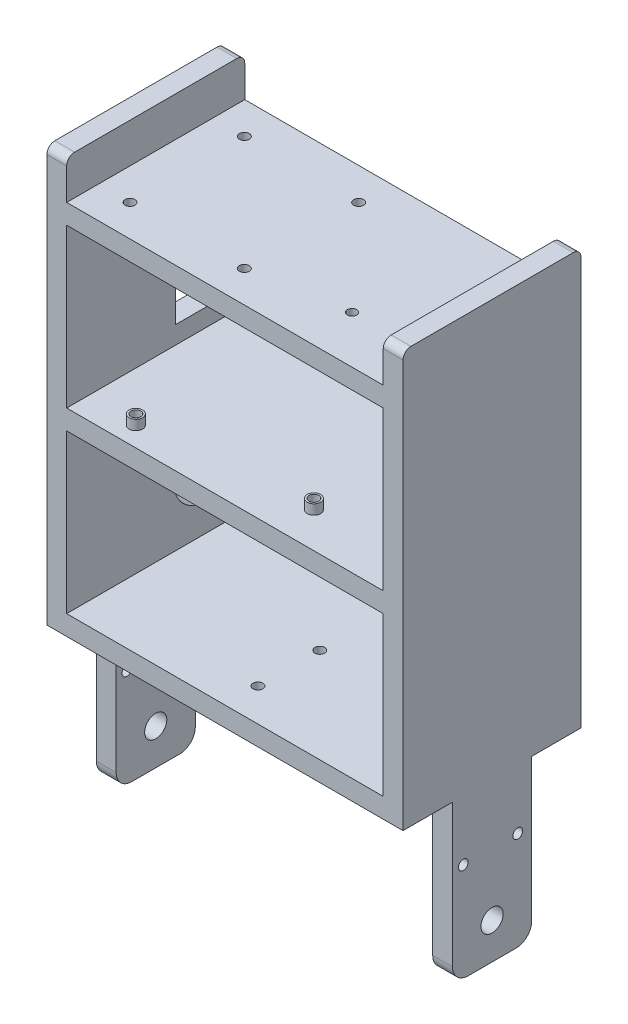
from build123d import *
from build123d.topology import SkipClean

# Parameters (mm, degrees)
SKETCH1_W                = 6.35
SKETCH1_H                = 127
SKETCH1_W_2              = 101.6
SKETCH1_H_2              = 6.35
BOSS_EXTRUDE1_DEPTH      = 57.15
SKETCH2_W                = 25.4
SKETCH2_H                = 50.8
BOSS_EXTRUDE2_DEPTH      = 6.35
BOSS_EXTRUDE3_DEPTH      = 0.508
FILLET1_R                = 5.00126
CUT_EXTRUDE8_DEPTH       = 181.488225001
SKETCH7_R                = 1.5748
CUT_EXTRUDE2_DEPTH       = 181.165514181
CUT_EXTRUDE3_DEPTH       = 6.35
BOSS_EXTRUDE6_START      = 3.81
BOSS_EXTRUDE6_DEPTH      = 3.81
SKETCH10_R               = 1.5875
CUT_EXTRUDE5_DEPTH       = 6.35
SKETCH11_R               = 1.5875
CUT_EXTRUDE6_DEPTH       = 6.35
SKETCH12_R               = 1.49987
CUT_EXTRUDE7_DEPTH       = 6.35
SKETCH9_W                = 12.7
SKETCH9_H                = 10.922
CUT_EXTRUDE4_DEPTH       = 6.35
SKETCH10_5_R             = 2.159
SKETCH10_5_R_2           = 1.5875
BOSS_EXTRUDE9_DEPTH      = 3.175
BOSS_EXTRUDE9_2_DEPTH    = 3.175
BOSS_EXTRUDE9_3_DEPTH    = 3.175
BOSS_EXTRUDE9_4_DEPTH    = 3.175
CUT_EXTRUDE9_START       = -6.35
CUT_EXTRUDE9_DEPTH       = 114.3
CUT_EXTRUDE9_2_OUTLINE_R = 1.5875
CUT_EXTRUDE9_2_DEPTH     = 6.35


# Read off the part's stored shape, not the designer's step: Cut-Extrude9
with BuildPart() as part:
    # Sketch1 → Boss-Extrude1 (new body)
    with BuildSketch(Plane.XY):
        with Locations((104.775, 63.5)):
            Rectangle(SKETCH1_W, SKETCH1_H)
        with Locations((-3.175, 63.5)):
            Rectangle(SKETCH1_W, SKETCH1_H)
        with Locations((50.8, 111.125)):
            Rectangle(SKETCH1_W_2, SKETCH1_H_2)
        with Locations((50.8, 53.975)):
            Rectangle(SKETCH1_W_2, SKETCH1_H_2)
        Polygon((107.95, -6.35), (101.6, -6.35), (0, -6.35), (-6.35, -6.35), (-6.35, 0), (0, 0), (101.6, 0), (107.95, 0), align=None)
    extrude(amount=-BOSS_EXTRUDE1_DEPTH)

    # Sketch2 → Boss-Extrude2 (add)
    with BuildSketch(Plane(origin=(107.95, 0, 0), x_dir=(0, 0, -1), z_dir=(1, 0, 0))):
        with Locations((28.575, -31.75)):
            Rectangle(SKETCH2_W, SKETCH2_H)
    boss_extrude2 = extrude(amount=-BOSS_EXTRUDE2_DEPTH)

    # Mirror1: Boss-Extrude2 across plane
    add(boss_extrude2.mirror(Plane(origin=(50.8, 0, 0), x_dir=(0, 0, 1), z_dir=(1, 0, 0))))

    # Sketch4 → Boss-Extrude3 (add)
    with BuildSketch(Plane.ZY.offset(6.35)):
        Polygon((-28.657476896, 66.071615527), (-28.737119471, 75.236068065), (-27.523959323, 75.247180983), (-27.453577513, 67.164385737), (-22.939880901, 67.203280948), (-22.930620136, 66.121623655), align=None)
        Polygon((-28.44342412, 49.573585988), (-28.523066695, 58.738038526), (-21.897915779, 58.795455265), (-21.888655015, 57.713797973), (-27.300645782, 57.665641998), (-27.276567795, 54.859630358), (-22.207225313, 54.904082027), (-22.197964549, 53.827981194), (-27.26730703, 53.783529524), (-27.239524737, 50.664504044), (-21.614536386, 50.714512173), (-21.605275622, 49.63285488), align=None)
        Polygon((-28.29340319, 31.651300701), (-28.373045764, 40.815753239), (-21.747894849, 40.873169979), (-21.738634085, 39.791512686), (-27.150624852, 39.743356711), (-27.126546864, 36.937345071), (-22.057204383, 36.981796741), (-22.047943619, 35.905695907), (-27.1172861, 35.861244237), (-27.089503806, 32.742218758), (-21.464515456, 32.792226886), (-21.455254691, 31.710569593), align=None)
        Polygon((-28.219320528, 13.727163261), (-28.298963103, 22.891615799), (-27.085802955, 22.902728717), (-27.046907744, 18.357545506), (-22.535063285, 22.941623927), (-20.890351512, 22.956441151), (-24.703934328, 19.209535839), (-20.642163024, 13.793840765), (-22.242423127, 13.779023542), (-25.546663897, 18.389032105), (-27.033942674, 16.914718398), (-27.00616038, 13.738276179), align=None)
    extrude(amount=BOSS_EXTRUDE3_DEPTH)

    # Fillet1
    fillet1_edges = [part.edges().sort_by_distance(p)[0] for p in [
        (104.775, -57.15, -41.275),
        (104.775, -57.15, -15.875),
        (-3.175, -57.15, -15.875),
        (-3.175, -57.15, -41.275),
    ]]
    fillet(fillet1_edges, radius=FILLET1_R)

    # Sketch5 → Cut-Extrude8 (cut, through all)
    with BuildSketch(Plane(origin=(107.95, 0, 0), x_dir=(0, 0, -1), z_dir=(1, 0, 0))):
        with BuildLine():
            ThreePointArc((25.019, -45.52696), (25.614159021, -44.090119021), (27.051, -43.49496))
            Line((27.051, -43.49496), (30.099, -43.49496))
            ThreePointArc((30.099, -43.49496), (31.535840979, -44.090119021), (32.131, -45.52696))
            ThreePointArc((32.131, -45.52696), (28.575, -41.97096), (25.019, -45.52696))
        make_face()
        with BuildLine():
            ThreePointArc((30.099, -47.55896), (32.131, -45.52696), (30.099, -43.49496))
            Line((30.099, -43.49496), (27.051, -43.49496))
            ThreePointArc((27.051, -43.49496), (25.019, -45.52696), (27.051, -47.55896))
            Line((27.051, -47.55896), (30.099, -47.55896))
        make_face()
        with BuildLine():
            ThreePointArc((27.051, -47.55896), (25.614159021, -46.963800979), (25.019, -45.52696))
            ThreePointArc((25.019, -45.52696), (28.575, -49.08296), (32.131, -45.52696))
            ThreePointArc((32.131, -45.52696), (31.535840979, -46.963800979), (30.099, -47.55896))
            Line((30.099, -47.55896), (27.051, -47.55896))
        make_face()
    extrude(amount=-CUT_EXTRUDE8_DEPTH, mode=Mode.SUBTRACT)

    # Sketch7 → Cut-Extrude2 (cut, through all)
    with BuildSketch(Plane.ZY.offset(6.35)):
        with Locations((-36.83508, -25.527)):
            Circle(SKETCH7_R)
        with Locations((-19.33448, -25.527)):
            Circle(SKETCH7_R)
    extrude(amount=-CUT_EXTRUDE2_DEPTH, mode=Mode.SUBTRACT)

    # Sketch8 → Cut-Extrude3 (cut)
    with BuildSketch(Plane.ZY.offset(6.35)):
        with BuildLine():
            ThreePointArc((-34.665970856, 21.27123), (-44.45, 29.083), (-54.234029144, 21.27123))
            Line((-54.234029144, 21.27123), (-34.665970856, 21.27123))
        make_face()
        with BuildLine():
            Line((-34.665970856, 21.27123), (-54.234029144, 21.27123))
            ThreePointArc((-54.234029144, 21.27123), (-54.483, 19.05), (-54.234029144, 16.82877))
            Line((-54.234029144, 16.82877), (-34.665970856, 16.82877))
            ThreePointArc((-34.665970856, 16.82877), (-34.479436992, 17.932430181), (-34.417, 19.05))
            ThreePointArc((-34.417, 19.05), (-34.479436992, 20.167569819), (-34.665970856, 21.27123))
        make_face()
        with BuildLine():
            Line((-34.665970856, 16.82877), (-54.234029144, 16.82877))
            ThreePointArc((-54.234029144, 16.82877), (-44.45, 9.017), (-34.665970856, 16.82877))
        make_face()
    extrude(amount=-CUT_EXTRUDE3_DEPTH, mode=Mode.SUBTRACT)

    # Sketch8<3> → Boss-Extrude6 (add)
    with SkipClean():  # the faces are left unmerged after this step: merging them gives an invalid solid
        with BuildSketch(Plane.ZY.offset(6.35).offset(BOSS_EXTRUDE6_START)):
            with BuildLine():
                ThreePointArc((-33.108466317, 21.27123), (-44.45, 30.607), (-55.791533683, 21.27123))
                Line((-55.791533683, 21.27123), (-54.234029144, 21.27123))
                ThreePointArc((-54.234029144, 21.27123), (-44.45, 29.083), (-34.665970856, 21.27123))
                Line((-34.665970856, 21.27123), (-33.108466317, 21.27123))
            make_face()
            with BuildLine():
                Line((-54.234029144, 16.82877), (-55.791533683, 16.82877))
                ThreePointArc((-55.791533683, 16.82877), (-44.45, 7.493), (-33.108466317, 16.82877))
                Line((-33.108466317, 16.82877), (-34.665970856, 16.82877))
                ThreePointArc((-34.665970856, 16.82877), (-44.45, 9.017), (-54.234029144, 16.82877))
            make_face()
        extrude(amount=-BOSS_EXTRUDE6_DEPTH)

    # Sketch10 → Cut-Extrude5 (cut)
    with SkipClean():  # the faces are left unmerged after this step: merging them gives an invalid solid
        with BuildSketch(Plane(origin=(0, 57.15, 0), x_dir=(1, 0, 0), z_dir=(0, 1, 0))):
            with Locations(Location((15.875, 6.31698, 0), (0, 0, 270))):
                Circle(SKETCH10_R)
            with Locations(Location((67.945, 11.39698, 0), (0, 0, 270))):
                Circle(SKETCH10_R)
            with Locations(Location((67.945, 39.33698, 0), (0, 0, 270))):
                Circle(SKETCH10_R)
            with Locations(Location((17.145, 54.57698, 0), (0, 0, 270))):
                Circle(SKETCH10_R)
        extrude(amount=-CUT_EXTRUDE5_DEPTH, mode=Mode.SUBTRACT)

    # Sketch11 → Cut-Extrude6 (cut)
    with SkipClean():  # the faces are left unmerged after this step: merging them gives an invalid solid
        with BuildSketch(Plane(origin=(0, 114.3, 0), x_dir=(1, 0, 0), z_dir=(0, 1, 0))):
            with Locations(Location((10.16, 10.16, 0), (0, 0, 270))):
                Circle(SKETCH11_R)
            with Locations(Location((46.86046, 10.16, 0), (0, 0, 270))):
                Circle(SKETCH11_R)
            with Locations(Location((46.86046, 46.86046, 0), (0, 0, 270))):
                Circle(SKETCH11_R)
            with Locations(Location((10.16, 46.86046, 0), (0, 0, 270))):
                Circle(SKETCH11_R)
        extrude(amount=-CUT_EXTRUDE6_DEPTH, mode=Mode.SUBTRACT)

    # Sketch12 → Cut-Extrude7 (cut)
    with SkipClean():  # the faces are left unmerged after this step: merging them gives an invalid solid
        with BuildSketch(Plane(origin=(0, 114.3, 0), x_dir=(1, 0, 0), z_dir=(0, 1, 0))):
            with Locations(Location((91.345643218, 15.24, 0), (0, 0, 270))):
                Circle(SKETCH12_R)
            with Locations(Location((76.344403218, 15.24, 0), (0, 0, 270))):
                Circle(SKETCH12_R)
        extrude(amount=-CUT_EXTRUDE7_DEPTH, mode=Mode.SUBTRACT)

    # Sketch9 → Cut-Extrude4 (cut)
    with SkipClean():  # the faces are left unmerged after this step: merging them gives an invalid solid
        with BuildSketch(Plane.ZY.offset(6.35)):
            with Locations((-41.23944, 68.326)):
                Rectangle(SKETCH9_W, SKETCH9_H)
        extrude(amount=-CUT_EXTRUDE4_DEPTH, mode=Mode.SUBTRACT)

    # Cut-Extrude9 outline → Cut-Extrude9 (cut)
    with SkipClean():  # the faces are left unmerged after this step: merging them gives an invalid solid
        with BuildSketch(Plane.YZ.offset(CUT_EXTRUDE9_START)):
            with BuildLine():
                ThreePointArc((124.46, 0), (126.256051224, -0.743948776), (127, -2.54))
                Line((127, -2.54), (127, 0))
                Line((127, 0), (124.46, 0))
            make_face()
            with BuildLine():
                ThreePointArc((127, -54.61), (126.256051224, -56.406051224), (124.46, -57.15))
                Line((124.46, -57.15), (127, -57.15))
                Line((127, -57.15), (127, -54.61))
            make_face()
        extrude(amount=CUT_EXTRUDE9_DEPTH, mode=Mode.SUBTRACT)

    # Cut-Extrude9 2 outline → Cut-Extrude9 2 (cut)
    with SkipClean():  # the faces are left unmerged after this step: merging them gives an invalid solid
        with BuildSketch(Plane(origin=(0, 0, 0), x_dir=(1, 0, 0), z_dir=(0, 1, 0)).offset(CUT_EXTRUDE9_START)):
            with Locations((50.8, 30.42412)):
                Circle(CUT_EXTRUDE9_2_OUTLINE_R)
            with Locations((50.8, 10.57402)):
                Circle(CUT_EXTRUDE9_2_OUTLINE_R)
        extrude(amount=CUT_EXTRUDE9_2_DEPTH, mode=Mode.SUBTRACT)


with BuildPart() as body_2:
    # Sketch10<5> → Boss-Extrude9 (new body)
    with BuildSketch(Plane(origin=(0, 57.15, 0), x_dir=(1, 0, 0), z_dir=(0, 1, 0))):
        with Locations(Location((15.875, 6.31698, 0), (0, 0, 270))):
            Circle(SKETCH10_5_R)
        with Locations(Location((15.875, 6.31698, 0), (0, 0, 270))):
            Circle(SKETCH10_5_R_2, mode=Mode.SUBTRACT)
    extrude(amount=BOSS_EXTRUDE9_DEPTH)


with BuildPart() as body_3:
    # Sketch10<5> → Boss-Extrude9 2 (new body)
    with BuildSketch(Plane(origin=(0, 57.15, 0), x_dir=(1, 0, 0), z_dir=(0, 1, 0))):
        with Locations(Location((67.945, 11.39698, 0), (0, 0, 270))):
            Circle(SKETCH10_5_R)
        with Locations(Location((67.945, 11.39698, 0), (0, 0, 270))):
            Circle(SKETCH10_5_R_2, mode=Mode.SUBTRACT)
    extrude(amount=BOSS_EXTRUDE9_2_DEPTH)


with BuildPart() as body_4:
    # Sketch10<5> → Boss-Extrude9 3 (new body)
    with BuildSketch(Plane(origin=(0, 57.15, 0), x_dir=(1, 0, 0), z_dir=(0, 1, 0))):
        with Locations(Location((67.945, 39.33698, 0), (0, 0, 270))):
            Circle(SKETCH10_5_R)
        with Locations(Location((67.945, 39.33698, 0), (0, 0, 270))):
            Circle(SKETCH10_5_R_2, mode=Mode.SUBTRACT)
    extrude(amount=BOSS_EXTRUDE9_3_DEPTH)


with BuildPart() as body_5:
    # Sketch10<5> → Boss-Extrude9 4 (new body)
    with BuildSketch(Plane(origin=(0, 57.15, 0), x_dir=(1, 0, 0), z_dir=(0, 1, 0))):
        with Locations(Location((17.145, 54.57698, 0), (0, 0, 270))):
            Circle(SKETCH10_5_R)
        with Locations(Location((17.145, 54.57698, 0), (0, 0, 270))):
            Circle(SKETCH10_5_R_2, mode=Mode.SUBTRACT)
    extrude(amount=BOSS_EXTRUDE9_4_DEPTH)


solid = Compound([part.part, body_2.part, body_3.part, body_4.part, body_5.part])
